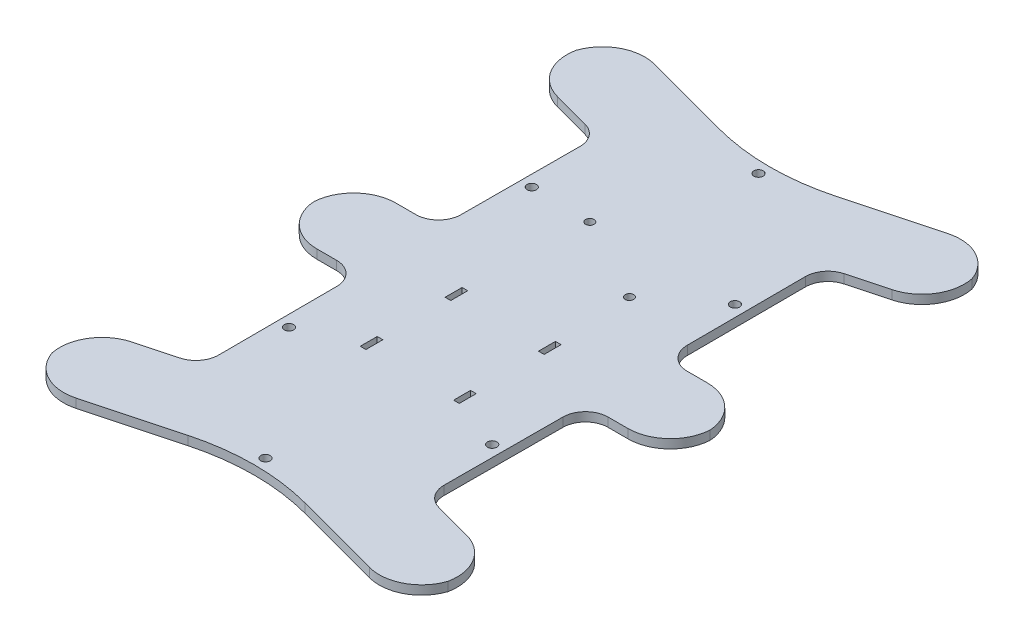
from build123d import *

# Parameters (mm, degrees)
BOSS_EXTRUDE1_DEPTH = 3.175
FILLET1_R           = 80
FILLET2_R           = 8
SKETCH2_R           = 1.65
CUT_EXTRUDE1_DEPTH  = 10
CUT_EXTRUDE2_DEPTH  = 10
SKETCH4_W           = 2
SKETCH4_H           = 6
CUT_EXTRUDE3_DEPTH  = 10
CUT_EXTRUDE4_START  = -10
CUT_EXTRUDE4_DEPTH  = 10
FILLET3_R           = 15


with BuildPart() as part:
    # Sketch1 → Boss-Extrude1 (new body)
    with BuildSketch(Plane(origin=(0, 0, 0), x_dir=(1, 0, 0), z_dir=(0, 1, 0))):
        with BuildLine():
            Line((-70, 14), (-40, 14))
            Line((-40, 14), (-39.816062711, 70))
            Line((-39.816062711, 70), (-73.623466631, 79.058666579))
            ThreePointArc((-73.623466631, 79.058666579), (-83.522961568, 96.205094778), (-66.376533369, 106.104589715))
            Line((-66.376533369, 106.104589715), (0, 88.319051202))
            Line((0, 88.319051202), (66.376533369, 106.104589715))
            ThreePointArc((66.376533369, 106.104589715), (83.522961568, 96.205094778), (73.623466631, 79.058666579))
            Line((73.623466631, 79.058666579), (39.816062711, 70))
            Line((39.816062711, 70), (40, 14))
            Line((40, 14), (70, 14))
            ThreePointArc((70, 14), (84, 0), (70, -14))
            Line((70, -14), (40, -14))
            Line((40, -14), (39.816062711, -70))
            Line((39.816062711, -70), (73.623466631, -79.058666579))
            ThreePointArc((73.623466631, -79.058666579), (83.522961568, -96.205094778), (66.376533369, -106.104589715))
            Line((66.376533369, -106.104589715), (0, -88.319051202))
            Line((0, -88.319051202), (-66.376533369, -106.104589715))
            ThreePointArc((-66.376533369, -106.104589715), (-83.522961568, -96.205094778), (-73.623466631, -79.058666579))
            Line((-73.623466631, -79.058666579), (-39.816062711, -70))
            Line((-39.816062711, -70), (-40, -14))
            Line((-40, -14), (-70, -14))
            ThreePointArc((-70, -14), (-84, 0), (-70, 14))
        make_face()
    extrude(amount=BOSS_EXTRUDE1_DEPTH)

    # Fillet1
    fillet1_edges = [part.edges().sort_by_distance(p)[0] for p in [
        (0, 1.5875, -88.319051202),
        (0, 1.5875, 88.319051202),
    ]]
    fillet(fillet1_edges, radius=FILLET1_R)

    # Fillet2
    fillet2_edges = [part.edges().sort_by_distance(p)[0] for p in [
        (-40, 1.5875, -14),
        (-39.816062711, 1.5875, -70),
        (39.816062711, 1.5875, -70),
        (40, 1.5875, -14),
        (40, 1.5875, 14),
        (39.816062711, 1.5875, 70),
        (-39.816062711, 1.5875, 70),
        (-40, 1.5875, 14),
    ]]
    fillet(fillet2_edges, radius=FILLET2_R)

    # Sketch2 → Cut-Extrude1 (cut)
    with BuildSketch(Plane(origin=(0, 3.175, 0), x_dir=(1, 0, 0), z_dir=(0, 1, 0))):
        with Locations(Location((0, 87.141145635, 0), (0, 0, 270))):
            Circle(SKETCH2_R)
        with Locations(Location((-35.905030257, 42.907120147, 0), (0, 0, 270))):
            Circle(SKETCH2_R)
        with Locations(Location((35.905030257, 42.907120147, 0), (0, 0, 270))):
            Circle(SKETCH2_R)
        with Locations(Location((35.905030257, -42.907120147, 0), (0, 0, 270))):
            Circle(SKETCH2_R)
        with Locations(Location((0, -87.141145635, 0), (0, 0, 270))):
            Circle(SKETCH2_R)
        with Locations(Location((-35.905030257, -42.907120147, 0), (0, 0, 270))):
            Circle(SKETCH2_R)
    extrude(amount=-CUT_EXTRUDE1_DEPTH, mode=Mode.SUBTRACT)

    # Sketch3 → Cut-Extrude2 (cut)
    with BuildSketch(Plane(origin=(0, 3.175, 0), x_dir=(1, 0, 0), z_dir=(0, 1, 0))):
        with BuildLine():
            ThreePointArc((13.5, 26.5), (15, 25), (16.5, 26.5))
            ThreePointArc((16.5, 26.5), (15, 28), (13.5, 26.5))
        make_face()
        with BuildLine():
            ThreePointArc((-16.5, 42.5), (-15, 41), (-13.5, 42.5))
            ThreePointArc((-13.5, 42.5), (-15, 44), (-16.5, 42.5))
        make_face()
    extrude(amount=-CUT_EXTRUDE2_DEPTH, mode=Mode.SUBTRACT)

    # Sketch4 → Cut-Extrude3 (cut)
    with BuildSketch(Plane(origin=(0, 3.175, 0), x_dir=(1, 0, 0), z_dir=(0, 1, 0))):
        with Locations((-16.5, -33.141145635)):
            Rectangle(SKETCH4_W, SKETCH4_H)
        with Locations((16.5, -3.141145635)):
            Rectangle(SKETCH4_W, SKETCH4_H)
        with Locations((16.5, -33.141145635)):
            Rectangle(SKETCH4_W, SKETCH4_H)
        with Locations((-16.5, -3.141145635)):
            Rectangle(SKETCH4_W, SKETCH4_H)
    extrude(amount=-CUT_EXTRUDE3_DEPTH, mode=Mode.SUBTRACT)

    # Sketch5 → Cut-Extrude4 (cut)
    with BuildSketch(Plane(origin=(0, 3.175, 0), x_dir=(1, 0, 0), z_dir=(0, 1, 0)).offset(CUT_EXTRUDE4_START)):
        with BuildLine():
            Line((-73.623466631, 79.058666579), (-66.376533369, 106.104589715))
            ThreePointArc((-66.376533369, 106.104589715), (-83.522961568, 96.205094778), (-73.623466631, 79.058666579))
        make_face()
        with BuildLine():
            Line((73.623466631, 79.058666579), (66.376533369, 106.104589715))
            ThreePointArc((66.376533369, 106.104589715), (83.522961568, 96.205094778), (73.623466631, 79.058666579))
        make_face()
        with BuildLine():
            Line((73.623466631, -79.058666579), (66.376533369, -106.104589715))
            ThreePointArc((66.376533369, -106.104589715), (83.522961568, -96.205094778), (73.623466631, -79.058666579))
        make_face()
        with BuildLine():
            Line((-73.623466631, -79.058666579), (-66.376533369, -106.104589715))
            ThreePointArc((-66.376533369, -106.104589715), (-83.522961568, -96.205094778), (-73.623466631, -79.058666579))
        make_face()
        with BuildLine():
            Line((-70, 14), (-70, -14))
            ThreePointArc((-70, -14), (-84, 0), (-70, 14))
        make_face()
        with BuildLine():
            Line((70, 14), (70, -14))
            ThreePointArc((70, -14), (84, 0), (70, 14))
        make_face()
    extrude(amount=CUT_EXTRUDE4_DEPTH, mode=Mode.SUBTRACT)

    # Fillet3
    # the kernel refuses this fillet: 15 mm, written as the material it takes off along each edge
    with BuildSketch(Plane(origin=(66.376533369, -37.5, -106.104589715), x_dir=(0.25881904510251735, 0, 0.9659258262890692), z_dir=(0, 1, 0)), Plane(origin=(73.623466631, -37.5, -79.058666579), x_dir=(-0.9659258262890694, 0, 0.2588190451025162), z_dir=(0, 1, 0)), Plane(origin=(70, -37.5, -14), x_dir=(0, 0, 1), z_dir=(0, 1, 0)), Plane(origin=(70, -37.5, 14), x_dir=(-1, 0, 0), z_dir=(0, 1, 0)), Plane(origin=(73.623466631, -37.5, 79.058666579), x_dir=(-0.2588190451025152, 0, 0.9659258262890699), z_dir=(0, 1, 0)), Plane(origin=(66.376533369, -37.5, 106.104589715), x_dir=(-0.9659258262890692, 0, -0.2588190451025171), z_dir=(0, 1, 0)), Plane(origin=(-66.376533369, -37.5, 106.104589715), x_dir=(-0.25881904510251846, 0, -0.965925826289069), z_dir=(0, 1, 0)), Plane(origin=(-73.623466631, -37.5, 79.058666579), x_dir=(0.9659258262890696, 0, -0.25881904510251585), z_dir=(0, 1, 0)), Plane(origin=(-70, -37.5, 14), x_dir=(0, 0, -1), z_dir=(0, 1, 0)), Plane(origin=(-70, -37.5, -14), x_dir=(1, 0, 0), z_dir=(0, 1, 0)), Plane(origin=(-73.623466631, -37.5, -79.058666579), x_dir=(0.2588190451025171, 0, -0.9659258262890692), z_dir=(0, 1, 0)), Plane(origin=(-66.376533369, -37.5, -106.104589715), x_dir=(0.9659258262890688, 0, 0.2588190451025186), z_dir=(0, 1, 0))) as fillet3_piece_1:
        with BuildLine():
            CenterArc((FILLET3_R, -FILLET3_R), FILLET3_R, 90, 90)
            Line((0, -FILLET3_R), (0, 0))
            Line((0, 0), (FILLET3_R, 0))
        make_face()
    extrude(amount=78.175, mode=Mode.SUBTRACT)


solid = part.part
